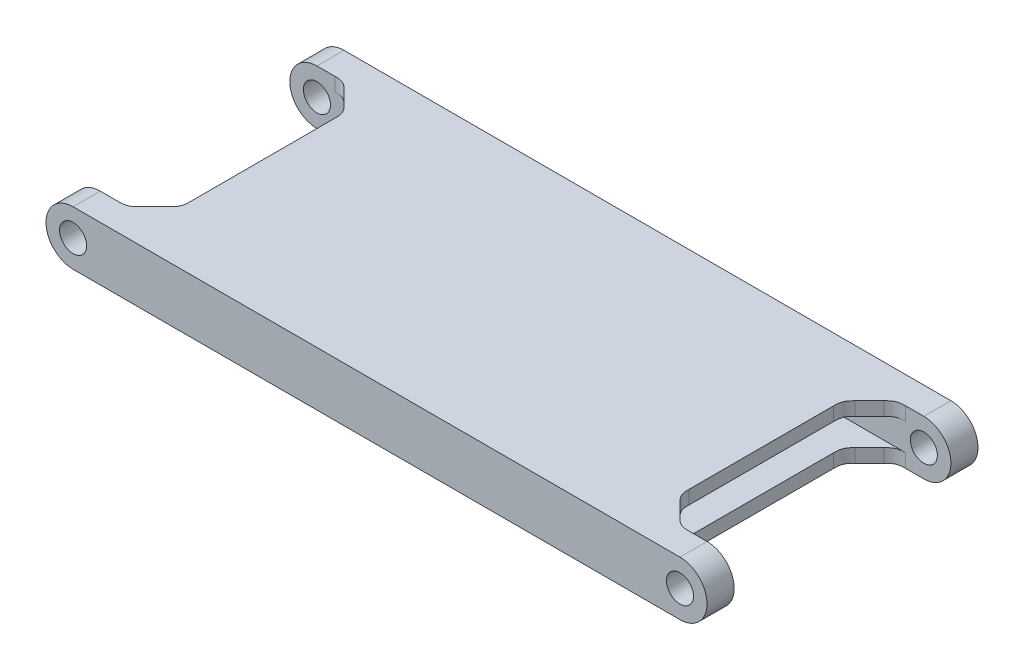
from build123d import *

# Parameters (mm, degrees)
SKETCH1_R           = 5
BOSS_EXTRUDE1_DEPTH = 5
BOSS_EXTRUDE2_DEPTH = 40
SKETCH4_W           = 48.223256465
SKETCH4_H           = 80
CUT_EXTRUDE1_DEPTH  = 40
CHAMFER1_SIZE       = 10


with BuildPart() as part:
    # Sketch1 → Boss-Extrude1 (new, symmetric)
    with BuildSketch(Plane.XY):
        with BuildLine():
            Line((-112, 10), (112, 10))
            ThreePointArc((112, 10), (122, 0), (112, -10))
            Line((112, -10), (-112, -10))
            ThreePointArc((-112, -10), (-122, 0), (-112, 10))
        make_face()
        with Locations((-112, 0)):
            Circle(SKETCH1_R, mode=Mode.SUBTRACT)
        with Locations(Location((112, 0, 0), (0, 0, 180))):
            Circle(SKETCH1_R, mode=Mode.SUBTRACT)
    extrude(amount=BOSS_EXTRUDE1_DEPTH, both=True)

    # Sketch2 → Boss-Extrude2 (add)
    with BuildSketch(Plane.XY.offset(5)):
        with BuildLine():
            Line((-112, -10), (112, -10))
            ThreePointArc((112, -10), (122, 0), (112, 10))
            Line((112, 10), (-112, 10))
            ThreePointArc((-112, 10), (-122, 0), (-112, -10))
        make_face()
        with BuildLine():
            Line((-112, -5), (112, -5))
            ThreePointArc((112, -5), (117, 0), (112, 5))
            Line((112, 5), (-112, 5))
            ThreePointArc((-112, 5), (-117, 0), (-112, -5))
        make_face(mode=Mode.SUBTRACT)
    extrude(amount=BOSS_EXTRUDE2_DEPTH)

    # Mirror1: part across plane


with BuildPart() as part_1:
    add(part.part)
    add(part.part.mirror(Plane(origin=(-112, 0, 45), x_dir=(1, 0, 0), z_dir=(0, 0, 1))))

    # Sketch4 → Cut-Extrude1 (cut)
    with BuildSketch(Plane(origin=(0, 10, 0), x_dir=(1, 0, 0), z_dir=(0, 1, 0))):
        with Locations((-116.111628233, -45)):
            Rectangle(SKETCH4_W, SKETCH4_H)
        with Locations((116.111628233, -45)):
            Rectangle(SKETCH4_W, SKETCH4_H)
    extrude(amount=-CUT_EXTRUDE1_DEPTH, mode=Mode.SUBTRACT)

    # Chamfer1
    chamfer1_edges = [part_1.edges().sort_by_distance(p)[0] for p in [
        (-92, 7.5, 5),
        (92, -7.5, 5),
        (92, 7.5, 5),
        (92, -7.5, 85),
        (92, 7.5, 85),
        (-92, -7.5, 85),
        (-92, 7.5, 85),
        (-92, -7.5, 5),
    ]]
    chamfer(chamfer1_edges, length=CHAMFER1_SIZE)

    # Fillet1
    # a fillet whose section is not a circle: 8 mm, written as the material it adds along each edge (its section moved 0.00015 mm through the faces so that the kernel can cut it)
    with BuildSketch(Plane(origin=(-92, -5, 15), x_dir=(4.5266504249621425e-05, 0, 0.9999999989754718), z_dir=(0, -1, 0)), Plane(origin=(-102, -5, 5), x_dir=(0.7071387887142107, 0, 0.7070747722099827), z_dir=(0, -1, 0)), Plane(origin=(-92, -5, 75), x_dir=(-0.707074772209981, 0, 0.7071387887142122), z_dir=(0, -1, 0)), Plane(origin=(-92, 10, 75), x_dir=(-0.707074772209981, 0, 0.7071387887142122), z_dir=(0, -1, 0)), Plane(origin=(102, 10, 85), x_dir=(-0.7071387887142122, 0, -0.707074772209981), z_dir=(0, -1, 0)), Plane(origin=(-102, 10, 5), x_dir=(0.7071387887142107, 0, 0.7070747722099827), z_dir=(0, -1, 0)), Plane(origin=(-92, 10, 15), x_dir=(4.5266504249621425e-05, 0, 0.9999999989754718), z_dir=(0, -1, 0))) as fillet1_piece_1:
        with BuildLine():
            add(Edge.make_bspline([(3.313708502, 0), (2.707126731, -2.7458e-05), (2.10054496, -5.4916e-05), (0.747296328, 0.113741147), (-0.448046284, 0.608804877), (-1.485482876, 1.485136275), (-1.914420376, 1.914034943), (-2.343357875, 2.342933611)], knots=[0, 0, 0, 0, 0, 0, 0.5, 0.5, 1, 1, 1, 1, 1, 1], degree=5))
            Line((-2.343357875, 2.342933611), (-2.456489839, 2.229791405))
            ThreePointArc((-2.456489839, 2.229791405), (-1.284757871, 1.058377635), (-0.113131964, -0.113142206))
            Line((-0.113131964, -0.113142206), (7.243e-06, -0.16))
            ThreePointArc((7.243e-06, -0.16), (1.65686149, -0.159925), (3.313715745, -0.16))
            Line((3.313715745, -0.16), (3.313708502, 0))
        make_face()
    extrude(amount=5)
    with BuildSketch(Plane(origin=(92, -5, 15), x_dir=(-4.526650424962133e-05, 0, 0.9999999989754718), z_dir=(0, -1, 0)), Plane(origin=(92, -5, 75), x_dir=(0.707074772209981, 0, 0.7071387887142122), z_dir=(0, -1, 0)), Plane(origin=(102, -5, 85), x_dir=(0.9999999989754718, 0, 4.526650424962133e-05), z_dir=(0, -1, 0)), Plane(origin=(-102, -5, 85), x_dir=(0.7071387887142122, 0, -0.707074772209981), z_dir=(0, -1, 0)), Plane(origin=(102, -5, 5), x_dir=(-0.7071387887142124, 0, 0.7070747722099809), z_dir=(0, -1, 0)), Plane(origin=(-102, 10, 85), x_dir=(0.7071387887142122, 0, -0.707074772209981), z_dir=(0, -1, 0)), Plane(origin=(92, 10, 75), x_dir=(0.707074772209981, 0, 0.7071387887142122), z_dir=(0, -1, 0)), Plane(origin=(92, 10, 15), x_dir=(-4.526650424962133e-05, 0, 0.9999999989754718), z_dir=(0, -1, 0)), Plane(origin=(102, 10, 5), x_dir=(-0.7071387887142124, 0, 0.7070747722099809), z_dir=(0, -1, 0))) as fillet1_piece_2:
        with BuildLine():
            add(Edge.make_bspline([(3.313708502, 0), (2.707126731, 2.7458e-05), (2.10054496, 5.4916e-05), (0.747296328, -0.113741147), (-0.448046284, -0.608804877), (-1.485482876, -1.485136275), (-1.914420376, -1.914034943), (-2.343357875, -2.342933611)], knots=[0, 0, 0, 0, 0, 0, 0.5, 0.5, 1, 1, 1, 1, 1, 1], degree=5))
            Line((-2.343357875, -2.342933611), (-2.456489839, -2.229791405))
            ThreePointArc((-2.456489839, -2.229791405), (-1.284757871, -1.058377635), (-0.113131964, 0.113142206))
            Line((-0.113131964, 0.113142206), (7.243e-06, 0.16))
            ThreePointArc((7.243e-06, 0.16), (1.65686149, 0.159925), (3.313715745, 0.16))
            Line((3.313715745, 0.16), (3.313708502, 0))
        make_face()
    extrude(amount=5)


solid = part_1.part
